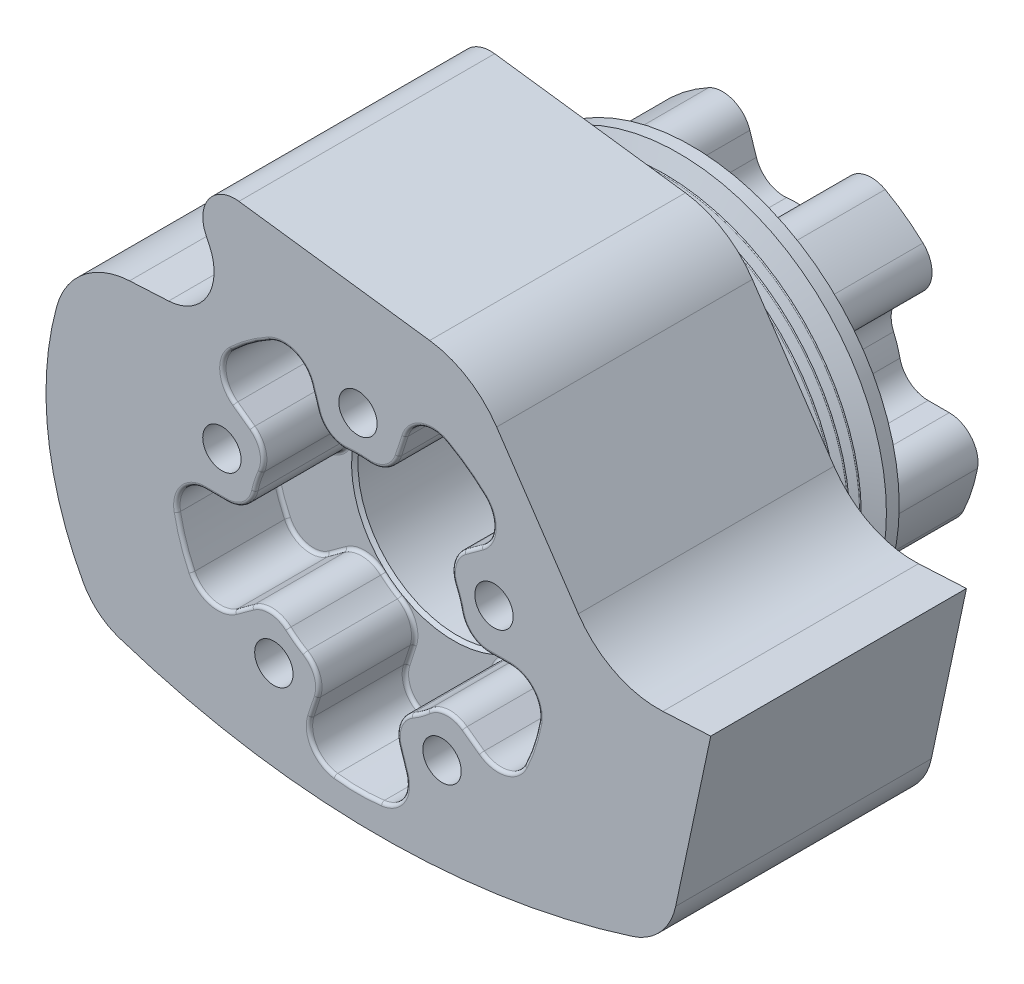
from build123d import *

# Parameters (mm, degrees)
RESSALTO_PRINCIPAL_ARMA_DEPTH                        = 80
ESBO_O2_R                                            = 20
FURO_EIXO_DEPTH                                      = 161.937958194
FILETE_REVOLU_O_POLIA_R                              = 1
ESBO_O6_R                                            = 20
RESSALTO_CAMISA_DEPTH                                = 33
FILETE1_R                                            = 1
ESBO_O2_5_R                                          = 31
ESBO_O2_5_R_2                                        = 20
REBAIXO_ROLAMENTO_DEPTH                              = 63
FILETE_REBAIXO_ROLAMENTO_R                           = 1
REBAIXO_START                                        = -104.334625498
REBAIXO_CAMISA_OUTLINE_R                             = 31
REBAIXO_CAMISA_DEPTH                                 = 30
FILETE_REBAIXO_CAMISA_R                              = 1
REBAIXO_START_2                                      = -30
ESBO_O2_6_R                                          = 31
ESBO_O2_6_R_2                                        = 20
REBAIXO_ROLAMENTO_ARMA_II_DEPTH                      = 46
CHANFRO_REBAIXO_ARMA_II_SIZE                         = 1
REBAIXO_PARA_PARAFUSO_ALLEN_SEXTAVADO_DE_D           = 12
REBAIXO_PARA_PARAFUSO_ALLEN_SEXTAVADO_DE_CBORE_D     = 18
REBAIXO_PARA_PARAFUSO_ALLEN_SEXTAVADO_DE_CBORE_DEPTH = 10.6


# Read off the part's stored shape, not the designer's step: REBAIXO CAMISA, Furo roscado de M102
with BuildPart() as part:
    # Esboço1 → RESSALTO PRINCIPAL ARMA (new body)
    with BuildSketch(Plane.XY):
        with BuildLine():
            Line((112.973397936, 10.920684904), (97.976789723, 10.134745971))
            ThreePointArc((97.976789723, 10.134745971), (83.020776642, 13.245601165), (71.535583859, 23.317844909))
            Line((71.535583859, 23.317844909), (46, 61.175904846))
            ThreePointArc((46, 61.175904846), (36.915290533, 69.910684492), (25.04465859, 74.143463584))
            Line((25.04465859, 74.143463584), (-34.631660207, 82))
            ThreePointArc((-34.631660207, 82), (-44.001368172, 77.99864787), (-45, 67.859368769))
            Line((-45, 67.859368769), (-43.815274599, 65.318716947))
            ThreePointArc((-43.815274599, 65.318716947), (-44.552381894, 51.253871898), (-56.624852061, 44))
            Line((-56.624852061, 44), (-68.848563686, 43.359382419))
            ThreePointArc((-68.848563686, 43.359382419), (-83.233421821, 37.854416991), (-91.661652202, 24.96280264))
            ThreePointArc((-91.661652202, 24.96280264), (-94.346256705, -11.125818881), (-83.340506358, -45.6))
            ThreePointArc((-83.340506358, -45.6), (-78.5851874, -51.375779671), (-72.040134597, -55))
            ThreePointArc((-72.040134597, -55), (8.207967193, -67.998312053), (88.547659519, -55.578658519))
            ThreePointArc((88.547659519, -55.578658519), (97.277155725, -49.945015038), (102.002702293, -40.692380142))
            Line((102.002702293, -40.692380142), (112.973397936, 10.920684904))
        make_face()
    extrude(amount=RESSALTO_PRINCIPAL_ARMA_DEPTH)

    # Esboço2 → FURO EIXO (cut, through all)
    with BuildSketch(Plane.XY.offset(80)):
        with Locations((2.6, -1.48)):
            Circle(ESBO_O2_R)
    extrude(amount=-FURO_EIXO_DEPTH, mode=Mode.SUBTRACT)

    # Esboço5 → REVOLUÇÃO POLIA (revolve)
    with BuildSketch(Plane(origin=(2.6, 0, 0), x_dir=(0, 0, -1), z_dir=(1, 0, 0)), mode=Mode.PRIVATE) as revolu_o_polia_sk:
        with BuildLine():
            Line((24.334625498, 63.52), (20.334625498, 63.52))
            Line((20.334625498, 63.52), (17.977159059, 57.042914193))
            ThreePointArc((17.977159059, 57.042914193), (17.507312749, 56.713924265), (17.037466439, 57.042914193))
            Line((17.037466439, 57.042914193), (15.962235904, 59.997085807))
            ThreePointArc((15.962235904, 59.997085807), (15.727312749, 60.161580771), (15.492389594, 59.997085807))
            Line((15.492389594, 59.997085807), (14.417159059, 57.042914193))
            ThreePointArc((14.417159059, 57.042914193), (13.947312749, 56.713924265), (13.477466439, 57.042914193))
            Line((13.477466439, 57.042914193), (12.402235904, 59.997085807))
            ThreePointArc((12.402235904, 59.997085807), (12.167312749, 60.161580771), (11.932389594, 59.997085807))
            Line((11.932389594, 59.997085807), (10.857159059, 57.042914193))
            ThreePointArc((10.857159059, 57.042914193), (10.387312749, 56.713924265), (9.917466439, 57.042914193))
            Line((9.917466439, 57.042914193), (8.842235904, 59.997085807))
            ThreePointArc((8.842235904, 59.997085807), (8.607312749, 60.161580771), (8.372389594, 59.997085807))
            Line((8.372389594, 59.997085807), (7.297159059, 57.042914193))
            ThreePointArc((7.297159059, 57.042914193), (6.827312749, 56.713924265), (6.357466439, 57.042914193))
            Line((6.357466439, 57.042914193), (4, 63.52))
            Line((4, 63.52), (0, 63.52))
            Line((0, 63.52), (0, 18.52))
            Line((0, 18.52), (24.334625498, 18.52))
            Line((24.334625498, 18.52), (24.334625498, 63.52))
        make_face()
    revolve(revolu_o_polia_sk.sketch.rotate(Axis((2.6, -1.48, 0), (0, 0, -1)), 90), axis=Axis((2.6, -1.48, 0), (0, 0, -1)))

    # FILETE REVOLUÇÃO POLIA
    filete_revolu_o_polia_edges = [part.edges().sort_by_distance(p)[0] for p in [
        (-62.4, -1.48, 0),
    ]]
    fillet(filete_revolu_o_polia_edges, radius=FILETE_REVOLU_O_POLIA_R)

    # Esboço6 → RESSALTO CAMISA (add)
    with BuildSketch(Plane(origin=(0, 0, -24.334625498), x_dir=(-1, 0, 0), z_dir=(0, 0, -1))):
        with BuildLine():
            Line((-43.624382994, -1.48), (-50.257633177, -1.48))
            ThreePointArc((-50.257633177, -1.48), (-57.186952329, -4.736783472), (-59.101317684, -12.150103093))
            ThreePointArc((-59.101317684, -12.150103093), (-57.285749687, -19.248477177), (-54.582255449, -26.058346536))
            ThreePointArc((-54.582255449, -26.058346536), (-48.6760614, -30.93061237), (-41.155835152, -29.49245394))
            Line((-41.155835152, -29.49245394), (-35.789423026, -25.593527308))
            ThreePointArc((-35.789423026, -25.593527308), (-30.057638833, -23.885526451), (-24.520922379, -26.147248774))
            ThreePointArc((-24.520922379, -26.147248774), (-21.996913326, -28.177560814), (-19.286010138, -29.950635147))
            ThreePointArc((-19.286010138, -29.950635147), (-15.424044907, -34.517454775), (-15.277231529, -40.496506773))
            Line((-15.277231529, -40.496506773), (-17.327018563, -46.805102584))
            ThreePointArc((-17.327018563, -46.805102584), (-16.370910797, -54.401678157), (-9.911996293, -58.51318955))
            ThreePointArc((-9.911996293, -58.51318955), (-2.6, -58.98), (4.711996293, -58.51318955))
            ThreePointArc((4.711996293, -58.51318955), (11.170910797, -54.401678157), (12.127018563, -46.805102584))
            Line((12.127018563, -46.805102584), (10.077231529, -40.496506773))
            ThreePointArc((10.077231529, -40.496506773), (10.224044907, -34.517454775), (14.086010138, -29.950635147))
            ThreePointArc((14.086010138, -29.950635147), (16.796913326, -28.177560814), (19.320922379, -26.147248774))
            ThreePointArc((19.320922379, -26.147248774), (24.857638833, -23.885526451), (30.589423026, -25.593527308))
            Line((30.589423026, -25.593527308), (35.955835152, -29.49245394))
            ThreePointArc((35.955835152, -29.49245394), (43.4760614, -30.93061237), (49.382255449, -26.058346536))
            ThreePointArc((49.382255449, -26.058346536), (52.085749687, -19.248477177), (53.901317684, -12.150103093))
            ThreePointArc((53.901317684, -12.150103093), (51.986952329, -4.736783472), (45.057633177, -1.48))
            Line((45.057633177, -1.48), (38.424382994, -1.48))
            ThreePointArc((38.424382994, -1.48), (32.783334459, 0.507256498), (29.633443781, 5.591428571))
            ThreePointArc((29.633443781, 5.591428571), (28.784865038, 8.717560814), (27.633885233, 11.745436996))
            ThreePointArc((27.633885233, 11.745436996), (27.193798957, 17.710077893), (30.589423026, 22.633527308))
            Line((30.589423026, 22.633527308), (35.955835152, 26.53245394))
            ThreePointArc((35.955835152, 26.53245394), (39.64748281, 33.240198723), (36.838796972, 40.362936003))
            ThreePointArc((36.838796972, 40.362936003), (31.197652007, 45.038477177), (25.007738445, 48.958703175))
            ThreePointArc((25.007738445, 48.958703175), (17.365681084, 49.428875277), (12.127018563, 43.845102584))
            Line((12.127018563, 43.845102584), (10.077231529, 37.536506773))
            ThreePointArc((10.077231529, 37.536506773), (6.444058424, 32.785646835), (0.635353693, 31.361018353))
            ThreePointArc((0.635353693, 31.361018353), (-2.6, 31.52), (-5.835353693, 31.361018353))
            ThreePointArc((-5.835353693, 31.361018353), (-11.644058424, 32.785646835), (-15.277231529, 37.536506773))
            Line((-15.277231529, 37.536506773), (-17.327018563, 43.845102584))
            ThreePointArc((-17.327018563, 43.845102584), (-22.565681084, 49.428875277), (-30.207738445, 48.958703175))
            ThreePointArc((-30.207738445, 48.958703175), (-36.397652007, 45.038477177), (-42.038796972, 40.362936003))
            ThreePointArc((-42.038796972, 40.362936003), (-44.84748281, 33.240198723), (-41.155835152, 26.53245394))
            Line((-41.155835152, 26.53245394), (-35.789423026, 22.633527308))
            ThreePointArc((-35.789423026, 22.633527308), (-32.393798957, 17.710077893), (-32.833885233, 11.745436996))
            ThreePointArc((-32.833885233, 11.745436996), (-33.984865038, 8.717560814), (-34.833443781, 5.591428571))
            ThreePointArc((-34.833443781, 5.591428571), (-37.983334459, 0.507256498), (-43.624382994, -1.48))
        make_face()
        with Locations(Location((-2.6, -1.48, 0), (0, 0, 180))):
            Circle(ESBO_O6_R, mode=Mode.SUBTRACT)
    extrude(amount=RESSALTO_CAMISA_DEPTH)

    # Filete1
    filete1_edges = [part.edges().sort_by_distance(p)[0] for p in [
        (48.6760614, -30.93061237, -24.334625498),
        (38.472629089, -27.542990624, -24.334625498),
        (30.057638833, -23.885526451, -24.334625498),
        (21.996913326, -28.177560814, -24.334625498),
        (15.424044907, -34.517454775, -24.334625498),
        (16.302125046, -43.650804678, -24.334625498),
        (16.370910797, -54.401678157, -24.334625498),
        (2.6, -58.98, -24.334625498),
        (-11.170910797, -54.401678157, -24.334625498),
        (-11.102125046, -43.650804678, -24.334625498),
        (-10.224044907, -34.517454775, -24.334625498),
        (-16.796913326, -28.177560814, -24.334625498),
        (-24.857638833, -23.885526451, -24.334625498),
        (-33.272629089, -27.542990624, -24.334625498),
        (-43.4760614, -30.93061237, -24.334625498),
        (-52.085749687, -19.248477177, -24.334625498),
        (-51.986952329, -4.736783472, -24.334625498),
        (-41.741008085, -1.48, -24.334625498),
        (-32.783334459, 0.507256498, -24.334625498),
        (-28.784865038, 8.717560814, -24.334625498),
        (-27.193798957, 17.710077893, -24.334625498),
        (-33.272629089, 24.582990624, -24.334625498),
        (-39.64748281, 33.240198723, -24.334625498),
        (-31.197652007, 45.038477177, -24.334625498),
        (-17.365681084, 49.428875277, -24.334625498),
        (-11.102125046, 40.690804678, -24.334625498),
        (-6.444058424, 32.785646835, -24.334625498),
        (2.6, 31.52, -24.334625498),
        (11.644058424, 32.785646835, -24.334625498),
        (16.302125046, 40.690804678, -24.334625498),
        (22.565681084, 49.428875277, -24.334625498),
        (36.397652007, 45.038477177, -24.334625498),
        (44.84748281, 33.240198723, -24.334625498),
        (38.472629089, 24.582990624, -24.334625498),
        (32.393798957, 17.710077893, -24.334625498),
        (33.984865038, 8.717560814, -24.334625498),
        (37.983334459, 0.507256498, -24.334625498),
        (46.941008085, -1.48, -24.334625498),
        (57.186952329, -4.736783472, -24.334625498),
        (57.285749687, -19.248477177, -24.334625498),
    ]]
    fillet(filete1_edges, radius=FILETE1_R)

    # Esboço2<5> → REBAIXO ROLAMENTO (cut)
    with BuildSketch(Plane.XY.offset(80)):
        with Locations((2.6, -1.48)):
            Circle(ESBO_O2_5_R)
        with Locations((2.6, -1.48)):
            Circle(ESBO_O2_5_R_2, mode=Mode.SUBTRACT)
    extrude(amount=-REBAIXO_ROLAMENTO_DEPTH, mode=Mode.SUBTRACT)

    # FILETE REBAIXO ROLAMENTO
    filete_rebaixo_rolamento_edges = [part.edges().sort_by_distance(p)[0] for p in [
        (-28.4, -1.48, 17),
    ]]
    fillet(filete_rebaixo_rolamento_edges, radius=FILETE_REBAIXO_ROLAMENTO_R)

    # REBAIXO CAMISA outline → REBAIXO CAMISA (cut)
    with BuildSketch(Plane(origin=(0, 0, -24.334625498), x_dir=(-1, 0, 0), z_dir=(0, 0, -1)).offset(REBAIXO_START)):
        with BuildLine():
            ThreePointArc((-32.833885233, 11.745436996), (-33.984865038, 8.717560814), (-34.833443781, 5.591428571))
            ThreePointArc((-34.833443781, 5.591428571), (-37.983334459, 0.507256498), (-43.624382994, -1.48))
            Line((-43.624382994, -1.48), (-50.257633177, -1.48))
            ThreePointArc((-50.257633177, -1.48), (-57.18695233, -4.736783473), (-59.101317684, -12.150103093))
            ThreePointArc((-59.101317684, -12.150103093), (-57.285749687, -19.248477177), (-54.582255449, -26.058346536))
            ThreePointArc((-54.582255449, -26.058346536), (-48.6760614, -30.93061237), (-41.155835152, -29.49245394))
            Line((-41.155835152, -29.49245394), (-35.789423026, -25.593527308))
            ThreePointArc((-35.789423026, -25.593527308), (-30.057638833, -23.885526451), (-24.520922379, -26.147248774))
            ThreePointArc((-24.520922379, -26.147248774), (-21.996913326, -28.177560814), (-19.286010138, -29.950635147))
            ThreePointArc((-19.286010138, -29.950635147), (-15.424044907, -34.517454775), (-15.277231529, -40.496506773))
            Line((-15.277231529, -40.496506773), (-17.327018563, -46.805102584))
            ThreePointArc((-17.327018563, -46.805102584), (-16.370910797, -54.401678157), (-9.911996293, -58.51318955))
            ThreePointArc((-9.911996293, -58.51318955), (-2.6, -58.98), (4.711996293, -58.51318955))
            ThreePointArc((4.711996293, -58.51318955), (11.170910797, -54.401678157), (12.127018563, -46.805102584))
            Line((12.127018563, -46.805102584), (10.077231529, -40.496506773))
            ThreePointArc((10.077231529, -40.496506773), (10.224044907, -34.517454775), (14.086010138, -29.950635147))
            ThreePointArc((14.086010138, -29.950635147), (16.796913326, -28.177560814), (19.320922379, -26.147248774))
            ThreePointArc((19.320922379, -26.147248774), (24.857638833, -23.885526451), (30.589423026, -25.593527308))
            Line((30.589423026, -25.593527308), (35.955835152, -29.49245394))
            ThreePointArc((35.955835152, -29.49245394), (43.4760614, -30.93061237), (49.382255449, -26.058346536))
            ThreePointArc((49.382255449, -26.058346536), (52.085749687, -19.248477177), (53.901317684, -12.150103093))
            ThreePointArc((53.901317684, -12.150103093), (51.98695233, -4.736783473), (45.057633177, -1.48))
            Line((45.057633177, -1.48), (38.424382994, -1.48))
            ThreePointArc((38.424382994, -1.48), (32.783334459, 0.507256498), (29.633443781, 5.591428571))
            ThreePointArc((29.633443781, 5.591428571), (28.784865038, 8.717560814), (27.633885233, 11.745436996))
            ThreePointArc((27.633885233, 11.745436996), (27.193798957, 17.710077893), (30.589423026, 22.633527308))
            Line((30.589423026, 22.633527308), (35.955835152, 26.53245394))
            ThreePointArc((35.955835152, 26.53245394), (39.64748281, 33.240198723), (36.838796972, 40.362936003))
            ThreePointArc((36.838796972, 40.362936003), (31.197652007, 45.038477177), (25.007738445, 48.958703175))
            ThreePointArc((25.007738445, 48.958703175), (17.365681085, 49.428875277), (12.127018563, 43.845102584))
            Line((12.127018563, 43.845102584), (10.077231529, 37.536506773))
            ThreePointArc((10.077231529, 37.536506773), (6.444058424, 32.785646835), (0.635353693, 31.361018353))
            ThreePointArc((0.635353693, 31.361018353), (-2.6, 31.52), (-5.835353693, 31.361018353))
            ThreePointArc((-5.835353693, 31.361018353), (-11.644058424, 32.785646835), (-15.277231529, 37.536506773))
            Line((-15.277231529, 37.536506773), (-17.327018563, 43.845102584))
            ThreePointArc((-17.327018563, 43.845102584), (-22.565681085, 49.428875277), (-30.207738445, 48.958703175))
            ThreePointArc((-30.207738445, 48.958703175), (-36.397652007, 45.038477177), (-42.038796972, 40.362936003))
            ThreePointArc((-42.038796972, 40.362936003), (-44.84748281, 33.240198723), (-41.155835152, 26.53245394))
            Line((-41.155835152, 26.53245394), (-35.789423026, 22.633527308))
            ThreePointArc((-35.789423026, 22.633527308), (-32.393798957, 17.710077893), (-32.833885233, 11.745436996))
        make_face()
        with Locations((-2.6, -1.48)):
            Circle(REBAIXO_CAMISA_OUTLINE_R, mode=Mode.SUBTRACT)
    extrude(amount=REBAIXO_CAMISA_DEPTH, mode=Mode.SUBTRACT)

    # FILETE REBAIXO CAMISA
    filete_rebaixo_camisa_edges = [part.edges().sort_by_distance(p)[0] for p in [
        (37.983334459, 0.507256498, 50),
        (30.057638833, -23.885526451, 50),
        (15.424044907, -34.517454775, 50),
        (-10.224044907, -34.517454775, 50),
        (-24.857638833, -23.885526451, 50),
        (-32.783334459, 0.507256498, 50),
        (-27.193798957, 17.710077893, 50),
        (-6.444058424, 32.785646835, 50),
        (11.644058424, 32.785646835, 50),
        (32.393798957, 17.710077893, 50),
        (33.984865038, 8.717560814, 80),
        (38.472629089, 24.582990624, 80),
        (44.84748281, 33.240198723, 80),
        (36.397652007, 45.038477177, 80),
        (22.565681085, 49.428875277, 80),
        (16.302125046, 40.690804679, 80),
        (2.6, 31.52, 80),
        (-11.102125046, 40.690804679, 80),
        (-17.365681085, 49.428875277, 80),
        (-31.197652007, 45.038477177, 80),
        (-39.64748281, 33.240198723, 80),
        (-33.272629089, 24.582990624, 80),
        (-28.784865038, 8.717560814, 80),
        (-41.741008085, -1.48, 80),
        (-51.98695233, -4.736783473, 80),
        (-52.085749687, -19.248477177, 80),
        (-43.4760614, -30.93061237, 80),
        (-33.272629089, -27.542990624, 80),
        (-16.796913326, -28.177560814, 80),
        (-11.102125046, -43.650804678, 80),
        (-11.170910797, -54.401678157, 80),
        (2.6, -58.98, 80),
        (16.370910797, -54.401678157, 80),
        (16.302125046, -43.650804678, 80),
        (21.996913326, -28.177560814, 80),
        (38.472629089, -27.542990624, 80),
        (48.6760614, -30.93061237, 80),
        (57.285749687, -19.248477177, 80),
        (57.18695233, -4.736783473, 80),
        (46.941008086, -1.48, 80),
        (37.983334459, 0.507256498, 80),
        (46.941008086, -1.48, 50),
        (57.18695233, -4.736783473, 50),
        (57.285749687, -19.248477177, 50),
        (48.6760614, -30.93061237, 50),
        (38.472629089, -27.542990624, 50),
        (30.057638833, -23.885526451, 80),
        (21.996913326, -28.177560814, 50),
        (15.424044907, -34.517454775, 80),
        (16.302125046, -43.650804678, 50),
        (16.370910797, -54.401678157, 50),
        (2.6, -58.98, 50),
        (-11.170910797, -54.401678157, 50),
        (-11.102125046, -43.650804678, 50),
        (-10.224044907, -34.517454775, 80),
        (-16.796913326, -28.177560814, 50),
        (-24.857638833, -23.885526451, 80),
        (-33.272629089, -27.542990624, 50),
        (-43.4760614, -30.93061237, 50),
        (-52.085749687, -19.248477177, 50),
        (-51.98695233, -4.736783473, 50),
        (-41.741008085, -1.48, 50),
        (-32.783334459, 0.507256498, 80),
        (-28.784865038, 8.717560814, 50),
        (-27.193798957, 17.710077893, 80),
        (-33.272629089, 24.582990624, 50),
        (-39.64748281, 33.240198723, 50),
        (-31.197652007, 45.038477177, 50),
        (-17.365681085, 49.428875277, 50),
        (-11.102125046, 40.690804679, 50),
        (-6.444058424, 32.785646835, 80),
        (2.6, 31.52, 50),
        (11.644058424, 32.785646835, 80),
        (16.302125046, 40.690804679, 50),
        (22.565681085, 49.428875277, 50),
        (36.397652007, 45.038477177, 50),
        (44.84748281, 33.240198723, 50),
        (38.472629089, 24.582990624, 50),
        (32.393798957, 17.710077893, 80),
        (33.984865038, 8.717560814, 50),
    ]]
    fillet(filete_rebaixo_camisa_edges, radius=FILETE_REBAIXO_CAMISA_R)

    # Esboço2<6> → REBAIXO ROLAMENTO ARMA II (cut)
    with BuildSketch(Plane.XY.offset(80).offset(REBAIXO_START_2)):
        with Locations((2.6, -1.48)):
            Circle(ESBO_O2_6_R)
        with Locations((2.6, -1.48)):
            Circle(ESBO_O2_6_R_2, mode=Mode.SUBTRACT)
    extrude(amount=-REBAIXO_ROLAMENTO_ARMA_II_DEPTH, mode=Mode.SUBTRACT)

    # CHANFRO REBAIXO ARMA II
    chanfro_rebaixo_arma_ii_edges = [part.edges().sort_by_distance(p)[0] for p in [
        (-28.4, -1.48, 50),
    ]]
    chamfer(chanfro_rebaixo_arma_ii_edges, length=CHANFRO_REBAIXO_ARMA_II_SIZE - 0.0001)  # a hair under: the kernel refuses the full size

    # Furo roscado de M102 outline → Furo roscado de M102 (revolve, cut)
    with BuildSketch(Plane(origin=(2.6, -44.73, 0), x_dir=(1, 0, 0), z_dir=(0, -1, 0))):
        Polygon((4.25, -29.834625498), (0, -27.280967867), (0, -57.334625498), (5.025, -57.334625498), (4.25, -56.559625498), align=None)
    revolve(axis=Axis((2.6, -44.73, 0), (0, 0, 1)), mode=Mode.SUBTRACT)

    # Furo roscado de M102 2 outline → Furo roscado de M102 2 (revolve, cut)
    with BuildSketch(Plane(origin=(-38.53319433, -14.844985007, 0), x_dir=(1, 0, 0), z_dir=(0, -1, 0))):
        Polygon((4.25, -29.834625498), (0, -27.280967867), (0, -57.334625498), (5.025, -57.334625498), (4.25, -56.559625498), align=None)
    revolve(axis=Axis((-38.53319433, -14.844985007, 0), (0, 0, 1)), mode=Mode.SUBTRACT)

    # Furo roscado de M102 3 outline → Furo roscado de M102 3 (revolve, cut)
    with BuildSketch(Plane(origin=(-22.821712162, 33.509985007, 0), x_dir=(1, 0, 0), z_dir=(0, -1, 0))):
        Polygon((4.25, -29.834625498), (0, -27.280967867), (0, -57.334625498), (5.025, -57.334625498), (4.25, -56.559625498), align=None)
    revolve(axis=Axis((-22.821712162, 33.509985007, 0), (0, 0, 1)), mode=Mode.SUBTRACT)

    # Furo roscado de M102 4 outline → Furo roscado de M102 4 (revolve, cut)
    with BuildSketch(Plane(origin=(28.021712162, 33.509985007, 0), x_dir=(1, 0, 0), z_dir=(0, -1, 0))):
        Polygon((4.25, -29.834625498), (0, -27.280967867), (0, -57.334625498), (5.025, -57.334625498), (4.25, -56.559625498), align=None)
    revolve(axis=Axis((28.021712162, 33.509985007, 0), (0, 0, 1)), mode=Mode.SUBTRACT)

    # Furo roscado de M102 5 outline → Furo roscado de M102 5 (revolve, cut)
    with BuildSketch(Plane(origin=(43.73319433, -14.844985007, 0), x_dir=(1, 0, 0), z_dir=(0, -1, 0))):
        Polygon((4.25, -29.834625498), (0, -27.280967867), (0, -57.334625498), (5.025, -57.334625498), (4.25, -56.559625498), align=None)
    revolve(axis=Axis((43.73319433, -14.844985007, 0), (0, 0, 1)), mode=Mode.SUBTRACT)

    # Rebaixo para parafuso Allen sextavado de M101 (through all)
    with Locations(Plane(origin=(0, 0, -24.334625498), x_dir=(-1, 0, 0), z_dir=(0, 0, -1))):
        with Locations((-45.159779104, 12.348510498), (-2.6, 43.27), (39.959779104, 12.348510498), (23.70339004, -37.683510498), (-28.90339004, -37.683510498)):
            CounterBoreHole(REBAIXO_PARA_PARAFUSO_ALLEN_SEXTAVADO_DE_D / 2, REBAIXO_PARA_PARAFUSO_ALLEN_SEXTAVADO_DE_CBORE_D / 2, REBAIXO_PARA_PARAFUSO_ALLEN_SEXTAVADO_DE_CBORE_DEPTH)


solid = part.part
